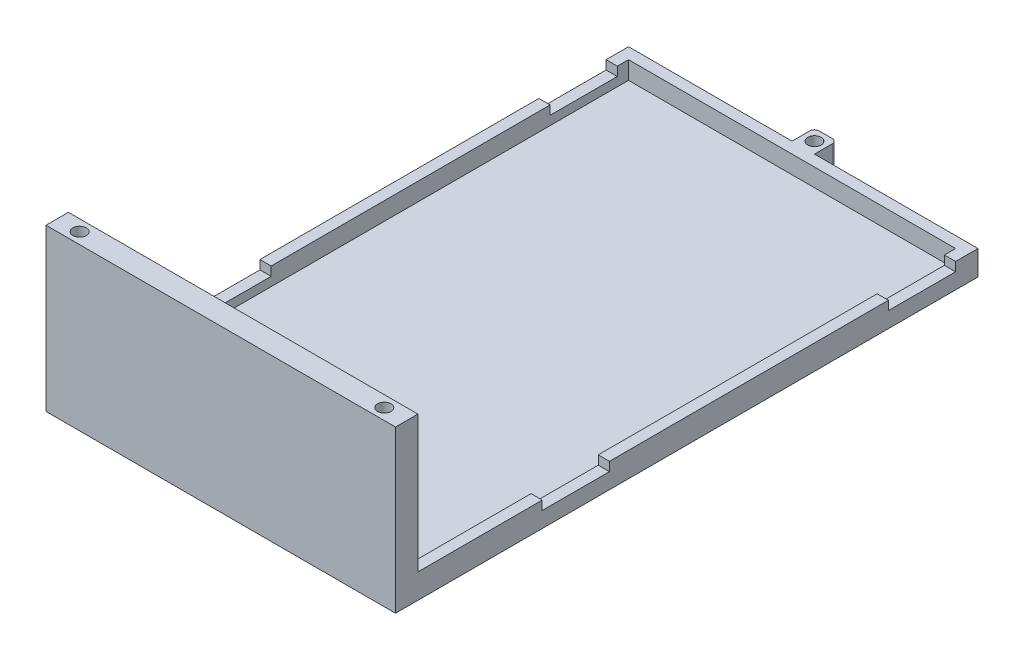
from build123d import *

# Parameters (mm, degrees)
SKETCH1_W           = 156
SKETCH1_H           = 260
BOSS_EXTRUDE1_DEPTH = 3
BOSS_EXTRUDE2_DEPTH = 8
SKETCH3_W           = 156
SKETCH3_H           = 10
BOSS_EXTRUDE3_DEPTH = 69
SKETCH4_R           = 3
CUT_EXTRUDE1_DEPTH  = 10
SKETCH5_W           = 5
SKETCH5_H           = 30
CUT_EXTRUDE2_DEPTH  = 4
SKETCH6_W           = 10
SKETCH6_H           = 10
BOSS_EXTRUDE4_DEPTH = 10
SKETCH7_R           = 3
CUT_EXTRUDE3_DEPTH  = 10
FILLET1_R           = 2


with BuildPart() as part:
    # Sketch1 → Boss-Extrude1 (new body)
    with BuildSketch(Plane(origin=(0, 0, 0), x_dir=(1, 0, 0), z_dir=(0, 1, 0))):
        Rectangle(SKETCH1_W, SKETCH1_H)
    extrude(amount=BOSS_EXTRUDE1_DEPTH)

    # Sketch2 → Boss-Extrude2 (add)
    with BuildSketch(Plane(origin=(0, 3, 0), x_dir=(1, 0, 0), z_dir=(0, 1, 0))):
        Polygon((-73, -120), (-73, 125), (73, 125), (73, -120), (78, -120), (78, 130), (-78, 130), (-78, -120), align=None)
    extrude(amount=BOSS_EXTRUDE2_DEPTH)

    # Sketch3 → Boss-Extrude3 (add)
    with BuildSketch(Plane(origin=(0, 3, 0), x_dir=(1, 0, 0), z_dir=(0, 1, 0))):
        with Locations((0, -125)):
            Rectangle(SKETCH3_W, SKETCH3_H)
    extrude(amount=BOSS_EXTRUDE3_DEPTH)

    # Sketch4 → Cut-Extrude1 (cut)
    with BuildSketch(Plane(origin=(0, 72, 0), x_dir=(1, 0, 0), z_dir=(0, 1, 0))):
        with Locations((-68, -125)):
            Circle(SKETCH4_R)
        with Locations((68, -125)):
            Circle(SKETCH4_R)
    extrude(amount=-CUT_EXTRUDE1_DEPTH, mode=Mode.SUBTRACT)

    # Sketch5 → Cut-Extrude2 (cut)
    with BuildSketch(Plane(origin=(0, 11, 0), x_dir=(1, 0, 0), z_dir=(0, 1, 0))):
        with Locations((-75.5, 105)):
            Rectangle(SKETCH5_W, SKETCH5_H)
        with Locations((-75.5, -49.5)):
            Rectangle(SKETCH5_W, SKETCH5_H)
        with Locations((75.5, 105)):
            Rectangle(SKETCH5_W, SKETCH5_H)
        with Locations((75.5, -49.5)):
            Rectangle(SKETCH5_W, SKETCH5_H)
    extrude(amount=-CUT_EXTRUDE2_DEPTH, mode=Mode.SUBTRACT)

    # Sketch6 → Boss-Extrude4 (add)
    with BuildSketch(Plane(origin=(0, 11, 0), x_dir=(1, 0, 0), z_dir=(0, 1, 0))):
        with Locations((0, 135)):
            Rectangle(SKETCH6_W, SKETCH6_H)
    extrude(amount=-BOSS_EXTRUDE4_DEPTH)

    # Sketch7 → Cut-Extrude3 (cut)
    with BuildSketch(Plane(origin=(0, 11, 0), x_dir=(1, 0, 0), z_dir=(0, 1, 0))):
        with Locations((0, 135)):
            Circle(SKETCH7_R)
    extrude(amount=-CUT_EXTRUDE3_DEPTH, mode=Mode.SUBTRACT)

    # Fillet1
    fillet1_edges = [part.edges().sort_by_distance(p)[0] for p in [
        (-5, 6, -140),
        (5, 6, -140),
    ]]
    fillet(fillet1_edges, radius=FILLET1_R)


solid = part.part
